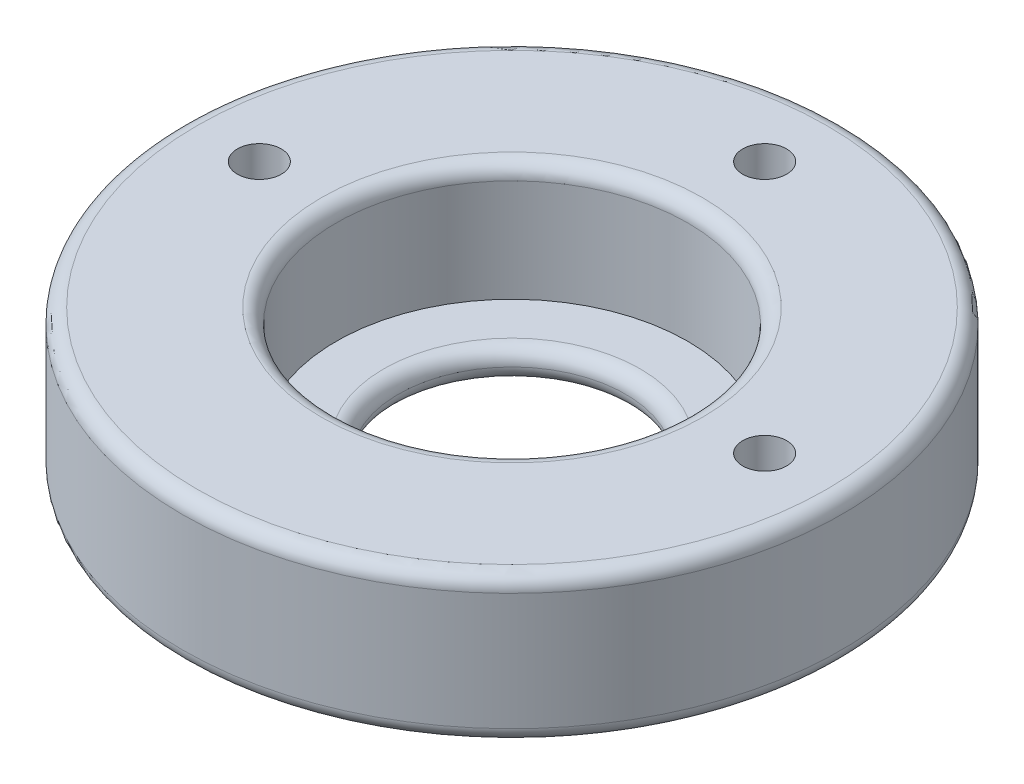
from build123d import *

# Parameters (mm, degrees)
SKETCH1_R           = 22.5
SKETCH1_R_2         = 1.5
BOSS_EXTRUDE1_DEPTH = 10
SKETCH2_R           = 12
CUT_EXTRUDE1_DEPTH  = 8
SKETCH3_R           = 7.75
CUT_EXTRUDE2_DEPTH  = 8
FILLET1_R           = 1
SKETCH4_R           = 3
CUT_EXTRUDE4_DEPTH  = 4


with BuildPart() as part:
    # Sketch1 → Boss-Extrude1 (new body)
    with BuildSketch(Plane(origin=(0, 0, 0), x_dir=(1, 0, 0), z_dir=(0, 1, 0))):
        with Locations(Location((0, 0, 0), (0, 0, 270))):
            Circle(SKETCH1_R)
        with Locations(Location((-17.25, 0, 0), (0, 0, 270))):
            Circle(SKETCH1_R_2, mode=Mode.SUBTRACT)
        with Locations(Location((0, 17.25, 0), (0, 0, 270))):
            Circle(SKETCH1_R_2, mode=Mode.SUBTRACT)
        with Locations(Location((17.25, 0, 0), (0, 0, 270))):
            Circle(SKETCH1_R_2, mode=Mode.SUBTRACT)
    extrude(amount=BOSS_EXTRUDE1_DEPTH)

    # Sketch2 → Cut-Extrude1 (cut)
    with BuildSketch(Plane(origin=(0, 10, 0), x_dir=(1, 0, 0), z_dir=(0, 1, 0))):
        with Locations(Location((0, 0, 0), (0, 0, 270))):
            Circle(SKETCH2_R)
    extrude(amount=-CUT_EXTRUDE1_DEPTH, mode=Mode.SUBTRACT)

    # Sketch3 → Cut-Extrude2 (cut)
    with BuildSketch(Plane(origin=(0, 2, 0), x_dir=(1, 0, 0), z_dir=(0, 1, 0))):
        with Locations(Location((0, 0, 0), (0, 0, 270))):
            Circle(SKETCH3_R)
    extrude(amount=-CUT_EXTRUDE2_DEPTH, mode=Mode.SUBTRACT)

    # Fillet1
    fillet1_edges = [part.edges().sort_by_distance(p)[0] for p in [
        (0, 10, -12),
        (0, 0, -7.75),
        (0, 2, -7.75),
        (0, 10, -22.5),
        (0, 0, -22.5),
    ]]
    fillet(fillet1_edges, radius=FILLET1_R - 0.0001)  # a hair under: the kernel refuses the full size

    # Sketch4 → Cut-Extrude4 (cut)
    with BuildSketch(Plane(origin=(0, 0, 0), x_dir=(1, 0, 0), z_dir=(0, 1, 0))):
        with Locations(Location((-17.25, 0, 0), (0, 0, 270))):
            Circle(SKETCH4_R)
        with Locations(Location((0, 17.25, 0), (0, 0, 270))):
            Circle(SKETCH4_R)
        with Locations(Location((17.25, 0, 0), (0, 0, 270))):
            Circle(SKETCH4_R)
    extrude(amount=CUT_EXTRUDE4_DEPTH, mode=Mode.SUBTRACT)


solid = part.part
